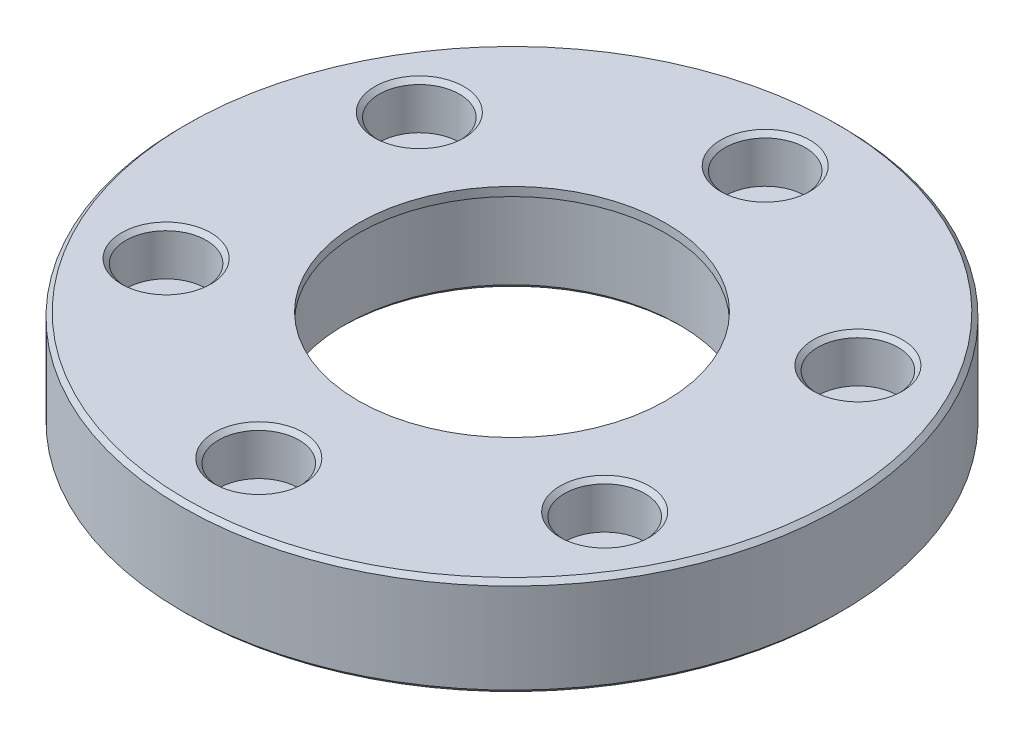
from build123d import *

# Parameters (mm, degrees)
SKETCH_1_R          = 15
SKETCH_1_R_2        = 7
SKETCH_1_R_3        = 1.83
EXTRUDE_1_DEPTH     = 2.1
EXTRUDE_START       = 2.4
SKETCH_2_R          = 15
SKETCH_2_R_2        = 7
SKETCH_2_R_3        = 0.9
EXTRUDE_2_DEPTH     = 2.4
SKETCH_3_R          = 7.6
CUT_EXTRUDE_1_DEPTH = 4.1
CHAMFER_1_SIZE      = 0.2
CHAMFER_2_SIZE      = 0.3


with BuildPart() as part:
    # 草图1 → 凸台-拉伸1 (new body)
    with BuildSketch(Plane(origin=(0, 0, 0), x_dir=(1, 0, 0), z_dir=(0, 1, 0))):
        Circle(SKETCH_1_R)
        Circle(SKETCH_1_R_2, mode=Mode.SUBTRACT)
        with Locations((0, 11.525)):
            Circle(SKETCH_1_R_3, mode=Mode.SUBTRACT)
        with Locations((9.980942779, 5.7625)):
            Circle(SKETCH_1_R_3, mode=Mode.SUBTRACT)
        with Locations((9.980942779, -5.7625)):
            Circle(SKETCH_1_R_3, mode=Mode.SUBTRACT)
        with Locations((0, -11.525)):
            Circle(SKETCH_1_R_3, mode=Mode.SUBTRACT)
        with Locations((-9.980942779, -5.7625)):
            Circle(SKETCH_1_R_3, mode=Mode.SUBTRACT)
        with Locations((-9.980942779, 5.7625)):
            Circle(SKETCH_1_R_3, mode=Mode.SUBTRACT)
    extrude(amount=EXTRUDE_1_DEPTH)

    # 草图2 → 凸台-拉伸2 (add)
    with BuildSketch(Plane(origin=(0, 0, 0), x_dir=(-1, 0, 0), z_dir=(0, -1, 0)).offset(EXTRUDE_START)):
        Circle(SKETCH_2_R)
        Circle(SKETCH_2_R_2, mode=Mode.SUBTRACT)
        with Locations((0, 11.53)):
            Circle(SKETCH_2_R_3, mode=Mode.SUBTRACT)
        with Locations((9.985272906, 5.765)):
            Circle(SKETCH_2_R_3, mode=Mode.SUBTRACT)
        with Locations((9.985272906, -5.765)):
            Circle(SKETCH_2_R_3, mode=Mode.SUBTRACT)
        with Locations((0, -11.53)):
            Circle(SKETCH_2_R_3, mode=Mode.SUBTRACT)
        with Locations((-9.985272906, -5.765)):
            Circle(SKETCH_2_R_3, mode=Mode.SUBTRACT)
        with Locations((-9.985272906, 5.765)):
            Circle(SKETCH_2_R_3, mode=Mode.SUBTRACT)
    extrude(amount=-EXTRUDE_2_DEPTH)

    # 草图3 → 切除-拉伸1 (cut)
    with BuildSketch(Plane(origin=(0, -2.4, 0), x_dir=(-1, 0, 0), z_dir=(0, -1, 0))):
        Circle(SKETCH_3_R)
    extrude(amount=-CUT_EXTRUDE_1_DEPTH, mode=Mode.SUBTRACT)

    # 倒角1
    chamfer_1_edges = [part.edges().sort_by_distance(p)[0] for p in [
        (15, -2.4, 0),
        (-11.810942779, 2.1, -5.7625),
        (-1.83, 2.1, 11.525),
        (8.150942779, 2.1, -5.7625),
        (-15, 2.1, 0),
        (-1.83, 2.1, -11.525),
        (8.150942779, 2.1, 5.7625),
        (-11.810942779, 2.1, 5.7625),
        (10.885272906, -2.4, -5.765),
        (0.9, -2.4, 11.53),
        (-9.085272906, -2.4, -5.765),
        (0.9, -2.4, -11.53),
        (-9.085272906, -2.4, 5.765),
        (10.885272906, -2.4, 5.765),
        (7.6, -2.4, 0),
    ]]
    chamfer(chamfer_1_edges, length=CHAMFER_1_SIZE)

    # 倒角2
    chamfer_2_edges = [part.edges().sort_by_distance(p)[0] for p in [
        (7.6, 1.7, 0),
    ]]
    chamfer(chamfer_2_edges, length=CHAMFER_2_SIZE)


solid = part.part
